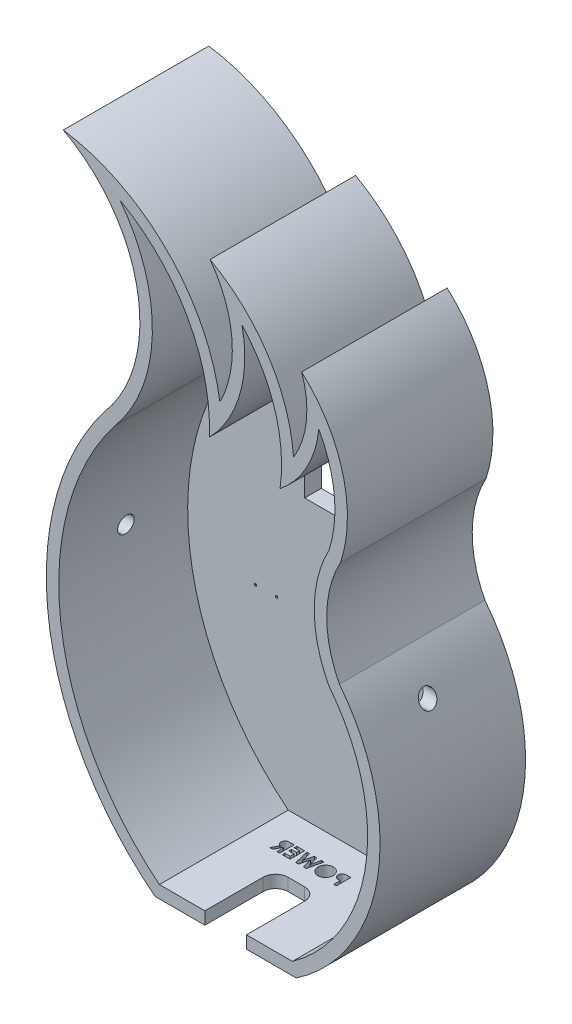
from build123d import *

# Parameters (mm, degrees)
BOSS_EXTRU_1_DEPTH           = 4
BOSS_EXTRU_4_DEPTH           = 35
ENL_V_MAT_EXTRU_1_DEPTH      = 109.428329438
ENL_V_MAT_EXTRU_1_DEPTH_BACK = 109.428329438
ENL_V_MAT_EXTRU_2_REACH      = 164.528
ESQUISSE6_R                  = 1.5
ESQUISSE6_R_2                = 2.5
ESQUISSE6_W                  = 24
ESQUISSE6_H                  = 15
ESQUISSE6_W_2                = 0.5
ESQUISSE6_H_2                = 0.5
ENL_V_MAT_EXTRU_3_DEPTH      = 109.428329601
ESQUISSE7_R                  = 5
ENL_V_MAT_EXTRU_4_DEPTH      = 1


with BuildPart() as part:
    # Esquisse1 → Boss.-Extru.1 (new body)
    with BuildSketch(Plane.XY):
        with BuildLine():
            Line((34.592208377, -83.205876128), (2.592208377, -83.205876128))
            ThreePointArc((2.592208377, -83.205876128), (-21.135858154, -40.364260111), (-8.228420805, 6.877916653))
            ThreePointArc((-8.228420805, 6.877916653), (0.893799042, 30.493713748), (-6.84321599, 54.598886756))
            ThreePointArc((-6.84321599, 54.598886756), (9.364765467, 38.345761161), (14.607820517, 15.99910306))
            ThreePointArc((14.607820517, 15.99910306), (21.976111447, 28.676093425), (22.456168695, 43.331035969))
            ThreePointArc((22.456168695, 43.331035969), (30.372692604, 29.597037977), (31.622475542, 13.794123872))
            ThreePointArc((31.622475542, 13.794123872), (38.001378496, 21.360207899), (40.944713977, 30.808636692))
            ThreePointArc((40.944713977, 30.808636692), (44.664931438, 19.085253837), (43.404645934, 6.850491723))
            ThreePointArc((43.404645934, 6.850491723), (39.847098611, -7.304052343), (43.389792333, -21.462321371))
            ThreePointArc((43.389792333, -21.462321371), (52.249922707, -54.223307802), (34.592208377, -83.205876128))
        make_face()
    extrude(amount=BOSS_EXTRU_1_DEPTH)

    # Esquisse3 → Boss.-Extru.4 (add)
    with BuildSketch(Plane.XY):
        with BuildLine():
            Line((1.54651487, -86.205876128), (35.532054588, -86.205876128))
            ThreePointArc((35.532054588, -86.205876128), (55.127345813, -55.266002734), (45.915235287, -19.820435684))
            ThreePointArc((45.915235287, -19.820435684), (42.848491015, -7.045180739), (46.174455308, 5.66505218))
            ThreePointArc((46.174455308, 5.66505218), (46.699040292, 24.566404446), (36.823600086, 40.691291659))
            ThreePointArc((36.823600086, 40.691291659), (37.958535424, 31.097022021), (34.873591151, 21.941629787))
            ThreePointArc((34.873591151, 21.941629787), (28.767463783, 40.061246758), (14.782629491, 53.100791247))
            ThreePointArc((14.782629491, 53.100791247), (20.048145675, 39.197474865), (17.15570326, 24.614551839))
            ThreePointArc((17.15570326, 24.614551839), (4.530733307, 49.705521169), (-20.51395608, 62.422051426))
            ThreePointArc((-20.51395608, 62.422051426), (-2.677497436, 37.981088624), (-10.559266028, 8.768460472))
            ThreePointArc((-10.559266028, 8.768460472), (-24.054003585, -41.210320933), (1.54651487, -86.205876128))
        make_face()
        with BuildLine():
            Line((2.592208377, -83.205876128), (34.592208377, -83.205876128))
            ThreePointArc((34.592208377, -83.205876128), (52.249922707, -54.223307802), (43.389792333, -21.462321371))
            ThreePointArc((43.389792333, -21.462321371), (39.847098611, -7.304052343), (43.404645934, 6.850491723))
            ThreePointArc((43.404645934, 6.850491723), (44.664931438, 19.085253837), (40.944713977, 30.808636692))
            ThreePointArc((40.944713977, 30.808636692), (38.001378496, 21.360207899), (31.622475542, 13.794123872))
            ThreePointArc((31.622475542, 13.794123872), (30.372692604, 29.597037977), (22.456168695, 43.331035969))
            ThreePointArc((22.456168695, 43.331035969), (21.976111447, 28.676093425), (14.607820517, 15.99910306))
            ThreePointArc((14.607820517, 15.99910306), (9.364765467, 38.345761161), (-6.84321599, 54.598886756))
            ThreePointArc((-6.84321599, 54.598886756), (0.893799042, 30.493713748), (-8.228420805, 6.877916653))
            ThreePointArc((-8.228420805, 6.877916653), (-21.135858154, -40.364260111), (2.592208377, -83.205876128))
        make_face(mode=Mode.SUBTRACT)
    extrude(amount=BOSS_EXTRU_4_DEPTH)

    # Esquisse4 → Enlèv. mat.-Extru.1 (cut, two sides: drawn at the far end of the back side and taken through both)
    with BuildSketch(Plane(origin=(0, 0, 0), x_dir=(0, 0, -1), z_dir=(1, 0, 0)).offset(-ENL_V_MAT_EXTRU_1_DEPTH_BACK)):
        with BuildLine():
            add(Edge.make_bspline(
                [(-21, -28.205876128), (-21, -28.337857478), (-20.987063571, -28.467669223), (-20.936340317, -28.723122141), (-20.897940296, -28.850084441), (-20.79762405, -29.092289965), (-20.736219813, -29.207190661), (-20.591103105, -29.424679205), (-20.506600116, -29.527694386), (-20.229641459, -29.804679288), (-20.00630231, -29.953837963), (-19.524411795, -30.153440552), (-19.260877309, -30.205916017), (-18.869102907, -30.205856149), (-18.736468273, -30.192755675), (-18.479710185, -30.14144783), (-18.35493159, -30.103530184), (-18.112617564, -30.003028482), (-17.995447069, -29.940202966), (-17.778679946, -29.795024799), (-17.67767738, -29.712169492), (-17.491015947, -29.525127406), (-17.408235442, -29.423773086), (-17.263634004, -29.206885886), (-17.201187039, -29.089882822), (-17.10116058, -28.847440434), (-17.063538557, -28.722760203), (-17.012768759, -28.466575309), (-16.999864688, -28.334144487), (-17.000273908, -27.943061162), (-17.052806967, -27.680421845), (-17.251995591, -27.199822701), (-17.400790494, -26.976885017), (-17.676983889, -26.700352659), (-17.779705149, -26.615909742), (-17.997207753, -26.470502871), (-18.11204999, -26.409018126), (-18.353968141, -26.308563097), (-18.481308283, -26.269904596), (-18.737253853, -26.218920837), (-18.867217224, -26.205926257), (-19.131268359, -26.205826286), (-19.261972106, -26.218823564), (-19.517792088, -26.269668849), (-19.644647717, -26.308067679), (-19.887281536, -26.408661877), (-20.002187961, -26.470169942), (-20.219400056, -26.615240979), (-20.322298667, -26.699707993), (-20.506737745, -26.884226558), (-20.589400692, -26.9848039), (-20.735292307, -27.202894296), (-20.797498381, -27.319356231), (-20.947021673, -27.679778766), (-21, -27.941913429), (-21, -28.205876128)],
                knots=[0, 0, 0, 0, 0.03125, 0.03125, 0.0625, 0.0625, 0.09375, 0.09375, 0.125, 0.125, 0.1875, 0.1875, 0.25, 0.25, 0.28125, 0.28125, 0.3125, 0.3125, 0.34375, 0.34375, 0.375, 0.375, 0.40625, 0.40625, 0.4375, 0.4375, 0.46875, 0.46875, 0.5, 0.5, 0.5625, 0.5625, 0.625, 0.625, 0.65625, 0.65625, 0.6875, 0.6875, 0.71875, 0.71875, 0.75, 0.75, 0.78125, 0.78125, 0.8125, 0.8125, 0.84375, 0.84375, 0.875, 0.875, 0.90625, 0.90625, 0.9375, 0.9375, 1, 1, 1, 1], degree=3))
        make_face()
    extrude(amount=ENL_V_MAT_EXTRU_1_DEPTH + ENL_V_MAT_EXTRU_1_DEPTH_BACK, mode=Mode.SUBTRACT)

    # Esquisse5 → Enlèv. mat.-Extru.2 (cut, up to next)
    with BuildSketch(Plane.XZ.offset(86.205876128), mode=Mode.PRIVATE) as enl_v_mat_extru_2_sk1:
        with BuildLine():
            Line((13.539284729, 35), (13.539284729, 21))
            ThreePointArc((13.539284729, 21), (14.417964385, 18.878679656), (16.539284729, 18))
            Line((16.539284729, 18), (20.539284729, 18))
            ThreePointArc((20.539284729, 18), (22.660605073, 18.878679656), (23.539284729, 21))
            Line((23.539284729, 21), (23.539284729, 35))
            Line((23.539284729, 35), (13.539284729, 35))
        make_face()
    enl_v_mat_extru_2_tool1 = extrude(enl_v_mat_extru_2_sk1.sketch, amount=-ENL_V_MAT_EXTRU_2_REACH, mode=Mode.PRIVATE) & part.part
    # Esquisse5 → Enlèv. mat.-Extru.2 (cut, up to next)
    with BuildSketch(Plane.XZ.offset(86.205876128), mode=Mode.PRIVATE) as enl_v_mat_extru_2_sk2:
        with BuildLine():
            Line((24.162892365, 10.5), (23.46177057, 10.5))
            add(Edge.make_bspline(
                [(23.46177057, 10.5), (23.415960181, 10.500205057), (23.327582339, 10.500600654), (23.200134223, 10.505397811), (23.08255708, 10.513994585), (22.974877994, 10.524618908), (22.877141008, 10.539513556), (22.789224474, 10.556589839), (22.711107747, 10.577391321), (22.641917663, 10.602090045), (22.579802645, 10.631183404), (22.521090871, 10.662258334), (22.466665992, 10.699092852), (22.415250267, 10.739031854), (22.367232631, 10.782906236), (22.322257263, 10.830542597), (22.280787285, 10.882633231), (22.243082686, 10.938819282), (22.208860014, 10.997956839), (22.178965773, 11.060180763), (22.154715969, 11.125581592), (22.134373755, 11.193738398), (22.118034596, 11.264647623), (22.107158754, 11.338745528), (22.099771329, 11.415514688), (22.099119491, 11.467763828), (22.098789801, 11.494190705)],
                knots=[0, 0, 0, 0, 1.698787518, 3.27731721, 4.728409951, 6.070286353, 7.288646904, 8.393455548, 9.389990496, 10.283725379, 11.113616976, 11.931887102, 12.744353494, 13.547053751, 14.344590688, 15.153907614, 15.974148981, 16.810666655, 17.660988447, 18.506082349, 19.367288142, 20.244738011, 21.142497992, 22.06302001, 23.020302899, 24, 24, 24, 24], degree=3))
            add(Edge.make_bspline(
                [(22.098789801, 11.494190705), (22.099264754, 11.523426976), (22.100198095, 11.580879842), (22.109416972, 11.665084258), (22.125010193, 11.745420189), (22.14588515, 11.82223083), (22.173113622, 11.895348142), (22.207240012, 11.964291802), (22.246275926, 12.029925726), (22.292359376, 12.091049462), (22.343281734, 12.147974158), (22.398113474, 12.201319297), (22.458499848, 12.248892295), (22.52228548, 12.293166415), (22.591295455, 12.331542946), (22.66348514, 12.367078015), (22.740685471, 12.397232775), (22.794408842, 12.413052953), (22.821646371, 12.421073718)],
                knots=[0, 0, 0, 0, 1.101767505, 2.165108537, 3.187936629, 4.183892551, 5.162396277, 6.123736501, 7.080098904, 8.036826416, 9.0040019, 9.957275584, 10.916231297, 11.898534744, 12.880877694, 13.889532316, 14.930001539, 16, 16, 16, 16], degree=3))
            add(Edge.make_bspline(
                [(22.821646371, 12.421073718), (22.839588592, 12.425537772), (22.87845722, 12.435208349), (22.942774124, 12.445026413), (23.016892603, 12.454053518), (23.10105233, 12.461811223), (23.195301826, 12.467084654), (23.299549832, 12.47120297), (23.413843592, 12.47419741), (23.493318953, 12.474303666), (23.534687237, 12.474358974)],
                knots=[0, 0, 0, 0, 0.618981996, 1.340914327, 2.176866532, 3.120127938, 4.170906482, 5.338178032, 6.614476169, 8, 8, 8, 8], degree=3))
            Line((23.534687237, 12.474358974), (23.534687237, 14))
            Line((23.534687237, 14), (24.162892365, 14))
            Line((24.162892365, 14), (24.162892365, 10.5))
        make_face()
        with BuildLine():
            Line((23.534687237, 11.846153846), (23.312431628, 11.846153846))
            add(Edge.make_bspline(
                [(23.312431628, 11.846153846), (23.27198805, 11.845898361), (23.197571265, 11.845428265), (23.095953398, 11.838594145), (23.014264542, 11.828203599), (22.949799696, 11.813179512), (22.898878956, 11.790808607), (22.855489213, 11.763826976), (22.816940138, 11.731403655), (22.784806455, 11.692533143), (22.758620608, 11.649166024), (22.740254163, 11.600974838), (22.728662051, 11.548729729), (22.727561104, 11.512249832), (22.726994929, 11.493489583)],
                knots=[0, 0, 0, 0, 1.862351722, 3.426754836, 4.68713255, 5.653025869, 6.462861518, 7.236406327, 7.999926698, 8.771672214, 9.54880311, 10.322347919, 11.137246204, 12, 12, 12, 12], degree=3))
            add(Edge.make_bspline(
                [(22.726994929, 11.493489583), (22.727543449, 11.4770949), (22.728607709, 11.445285273), (22.736533808, 11.39940838), (22.748835516, 11.356725531), (22.767636291, 11.317831711), (22.790462144, 11.281819759), (22.819419579, 11.249810734), (22.852813452, 11.220769037), (22.878638309, 11.205416166), (22.891758551, 11.197616186)],
                knots=[0, 0, 0, 0, 1.102449765, 2.139017612, 3.12397484, 4.080535277, 5.035673127, 5.982361139, 6.974944601, 8, 8, 8, 8], degree=3))
            add(Edge.make_bspline(
                [(22.891758551, 11.197616186), (22.902869344, 11.191997139), (22.926393171, 11.180100465), (22.966456528, 11.166269712), (23.012689031, 11.154601949), (23.065402801, 11.144917817), (23.124387546, 11.137401926), (23.189632745, 11.131654149), (23.26123441, 11.129342744), (23.311029084, 11.128594793), (23.33697089, 11.128205128)],
                knots=[0, 0, 0, 0, 0.656809284, 1.390599849, 2.23162475, 3.173112763, 4.218524733, 5.370385145, 6.63003504, 8, 8, 8, 8], degree=3))
            Line((23.33697089, 11.128205128), (23.534687237, 11.128205128))
            Line((23.534687237, 11.128205128), (23.534687237, 11.846153846))
        make_face(mode=Mode.SUBTRACT)
    enl_v_mat_extru_2_tool2 = extrude(enl_v_mat_extru_2_sk2.sketch, amount=-ENL_V_MAT_EXTRU_2_REACH, mode=Mode.PRIVATE) & part.part
    # Esquisse5 → Enlèv. mat.-Extru.2 (cut, up to next)
    with BuildSketch(Plane.XZ.offset(86.205876128), mode=Mode.PRIVATE) as enl_v_mat_extru_2_sk3:
        with BuildLine():
            add(Edge.make_bspline(
                [(19.825752942, 10.41025641), (19.764900849, 10.411831339), (19.644765034, 10.414940605), (19.468093862, 10.440878308), (19.297818104, 10.483091434), (19.13391335, 10.542014161), (18.976938596, 10.618324376), (18.826317078, 10.710979817), (18.682461558, 10.820766704), (18.547049246, 10.946118372), (18.422879471, 11.083186499), (18.313732829, 11.229320869), (18.221081165, 11.383012705), (18.145875585, 11.544291954), (18.08714545, 11.712937081), (18.046328698, 11.889012087), (18.020011023, 12.072291501), (18.016991221, 12.197090352), (18.015456467, 12.260516827)],
                knots=[0, 0, 0, 0, 1.014151002, 2.002163778, 2.969868608, 3.93493411, 4.9003771, 5.874719092, 6.87846472, 7.912488755, 8.947011879, 9.957751389, 10.948740761, 11.933621513, 12.919426746, 13.920294397, 14.943031967, 16, 16, 16, 16], degree=3))
            add(Edge.make_bspline(
                [(18.015456467, 12.260516827), (18.017091429, 12.323228512), (18.020313175, 12.446803899), (18.045251113, 12.62839604), (18.086777273, 12.802578596), (18.14437516, 12.969411115), (18.218265755, 13.128896333), (18.309502449, 13.280516738), (18.417485815, 13.424583864), (18.540010058, 13.5602151), (18.674066443, 13.684128709), (18.816901097, 13.792909636), (18.967187013, 13.884404437), (19.123963991, 13.960347086), (19.288711044, 14.017415825), (19.459601632, 14.060131946), (19.638065307, 14.084832759), (19.759305756, 14.088090183), (19.820845089, 14.08974359)],
                knots=[0, 0, 0, 0, 1.051517626, 2.07204922, 3.067438659, 4.05042616, 5.027204762, 6.009981242, 7.012629434, 8.042243656, 9.071350414, 10.070091277, 11.048190212, 12.017682766, 12.985867053, 13.966945899, 14.968060614, 16, 16, 16, 16], degree=3))
            add(Edge.make_bspline(
                [(19.820845089, 14.08974359), (19.885212835, 14.08827779), (20.011686656, 14.085397695), (20.196827606, 14.058240346), (20.373955828, 14.016835351), (20.542585985, 13.956890881), (20.702586988, 13.879001388), (20.854676372, 13.784955769), (20.997710291, 13.672937404), (21.13121197, 13.546324957), (21.252150725, 13.407747241), (21.358906582, 13.261361497), (21.44895659, 13.108274754), (21.522305377, 12.948418287), (21.580130553, 12.782784804), (21.620919659, 12.61036575), (21.645014754, 12.431574594), (21.648371062, 12.310136069), (21.650071852, 12.248597756)],
                knots=[0, 0, 0, 0, 1.067953136, 2.098381936, 3.099641766, 4.083805132, 5.062469929, 6.048665414, 7.046702845, 8.073106546, 9.098695993, 10.09591865, 11.076726721, 12.041940862, 13.011263376, 13.984305721, 14.978557872, 16, 16, 16, 16], degree=3))
            add(Edge.make_bspline(
                [(21.650071852, 12.248597756), (21.649530681, 12.207199796), (21.648455192, 12.124928068), (21.635784252, 12.00297392), (21.6169917, 11.883574953), (21.591265145, 11.766506639), (21.556602923, 11.652070672), (21.514473806, 11.539978393), (21.465380107, 11.430230422), (21.408766535, 11.323819274), (21.34472529, 11.222018101), (21.276346519, 11.123937766), (21.201011172, 11.032153071), (21.120274202, 10.945667009), (21.03381937, 10.864874927), (20.941496105, 10.789500956), (20.843449723, 10.71973734), (20.740740725, 10.655007593), (20.633720456, 10.59831439), (20.524935129, 10.546926154), (20.413340417, 10.505260585), (20.299746574, 10.470751849), (20.184414762, 10.443057187), (20.066454519, 10.424642598), (19.946861402, 10.411871556), (19.866218233, 10.41079607), (19.825752942, 10.41025641)],
                knots=[0, 0, 0, 0, 1.034641744, 2.056182551, 3.061960284, 4.05571729, 5.050247014, 6.048716841, 7.047801973, 8.054190544, 9.059424999, 10.053182006, 11.041513076, 12.025412457, 13.009311837, 13.997642908, 15.002928308, 16.016213968, 17.030509951, 18.02913364, 19.022134519, 20.005478534, 20.996155877, 21.984625117, 22.988721131, 24, 24, 24, 24], degree=3))
        make_face()
        with BuildLine():
            add(Edge.make_bspline(
                [(19.835568647, 11.038461538), (19.876521891, 11.039560407), (19.957347207, 11.041729135), (20.075903261, 11.058251865), (20.189721128, 11.084640646), (20.298170484, 11.122864107), (20.401719098, 11.171514181), (20.500558982, 11.230414994), (20.593289359, 11.30161371), (20.681270323, 11.381202759), (20.760478619, 11.470249581), (20.831697607, 11.564638711), (20.889281049, 11.666641313), (20.938794589, 11.772897694), (20.975367996, 11.886094968), (21.003214832, 12.004395951), (21.018382058, 12.129015087), (21.02068862, 12.213737994), (21.021866724, 12.257011218)],
                knots=[0, 0, 0, 0, 1.033668485, 2.040047952, 3.016132939, 3.979056467, 4.937231767, 5.900589077, 6.877725736, 7.88429546, 8.891280164, 9.882584218, 10.863295226, 11.842887319, 12.837417301, 13.860812229, 14.907384602, 16, 16, 16, 16], degree=3))
            add(Edge.make_bspline(
                [(21.021866724, 12.257011218), (21.020434681, 12.304981039), (21.017628115, 12.398993941), (20.998168059, 12.536210947), (20.964070247, 12.665649698), (20.917488528, 12.78774321), (20.855568135, 12.9012076), (20.781509948, 13.007418434), (20.693459711, 13.105716727), (20.625745728, 13.163155183), (20.591377942, 13.192307692)],
                knots=[0, 0, 0, 0, 1.078343132, 2.113373867, 3.107373148, 4.082093053, 5.043582658, 6.005574554, 6.987742499, 8, 8, 8, 8], degree=3))
            add(Edge.make_bspline(
                [(20.591377942, 13.192307692), (20.563216663, 13.213841032), (20.507528585, 13.256422561), (20.418638287, 13.310999526), (20.327098783, 13.357777429), (20.232219294, 13.395573422), (20.134200199, 13.425303114), (20.033054941, 13.446122329), (19.928926832, 13.459188186), (19.858510526, 13.460749804), (19.822948455, 13.461538462)],
                knots=[0, 0, 0, 0, 1.023928204, 2.024787132, 3.009472467, 3.9914905, 4.972207045, 5.96565515, 6.972602802, 8, 8, 8, 8], degree=3))
            add(Edge.make_bspline(
                [(19.822948455, 13.461538462), (19.782700181, 13.460428703), (19.703510438, 13.458245219), (19.587150245, 13.441948345), (19.475725355, 13.414247454), (19.368202976, 13.376630647), (19.266022913, 13.32621761), (19.167591745, 13.266355995), (19.074082603, 13.195178847), (18.986635422, 13.113584088), (18.906494755, 13.024533066), (18.835592567, 12.929633395), (18.776873867, 12.82888138), (18.727894998, 12.723622851), (18.689735004, 12.61301973), (18.663620024, 12.497063674), (18.646836425, 12.376222513), (18.644733106, 12.293993782), (18.643661596, 12.252103365)],
                knots=[0, 0, 0, 0, 1.026350473, 2.019376834, 2.989435443, 3.95094063, 4.91865229, 5.889827372, 6.885283771, 7.910196595, 8.935871797, 9.9372888, 10.925850568, 11.904605667, 12.894245083, 13.903507864, 14.931967858, 16, 16, 16, 16], degree=3))
            add(Edge.make_bspline(
                [(18.643661596, 12.252103365), (18.644766029, 12.210452112), (18.646939939, 12.128467972), (18.66332814, 12.007962039), (18.690572967, 11.892643124), (18.729078614, 11.782213962), (18.777048639, 11.67609481), (18.837306976, 11.57520669), (18.908547496, 11.479636889), (18.989467862, 11.389953581), (19.077530219, 11.307534841), (19.172077777, 11.236011765), (19.270460467, 11.173860119), (19.374936851, 11.125173118), (19.483369123, 11.086384264), (19.596419024, 11.057819602), (19.714514715, 11.041845204), (19.794857657, 11.039599481), (19.835568647, 11.038461538)],
                knots=[0, 0, 0, 0, 1.055040155, 2.076685641, 3.074845078, 4.052329834, 5.035358467, 6.020382375, 7.023447318, 8.050688466, 9.077178457, 10.074336316, 11.0503314, 12.019748348, 12.988025369, 13.964577102, 14.968620271, 16, 16, 16, 16], degree=3))
        make_face(mode=Mode.SUBTRACT)
    enl_v_mat_extru_2_tool3 = extrude(enl_v_mat_extru_2_sk3.sketch, amount=-ENL_V_MAT_EXTRU_2_REACH, mode=Mode.PRIVATE) & part.part
    # Esquisse5 → Enlèv. mat.-Extru.2 (cut, up to next)
    with BuildSketch(Plane.XZ.offset(86.205876128), mode=Mode.PRIVATE) as enl_v_mat_extru_2_sk4:
        Polygon((17.723789801, 10.5), (17.07525214, 10.5), (16.557123134, 12.73447516), (15.963272974, 10.5), (15.35259589, 10.5), (14.762251339, 12.73447516), (14.245524576, 10.5), (13.595584673, 10.5), (14.405380346, 14), (15.061630346, 14), (15.659687237, 11.737479968), (16.261249737, 14), (16.912591884, 14), align=None)
    enl_v_mat_extru_2_tool4 = extrude(enl_v_mat_extru_2_sk4.sketch, amount=-ENL_V_MAT_EXTRU_2_REACH, mode=Mode.PRIVATE) & part.part
    # Esquisse5 → Enlèv. mat.-Extru.2 (cut, up to next)
    with BuildSketch(Plane.XZ.offset(86.205876128), mode=Mode.PRIVATE) as enl_v_mat_extru_2_sk5:
        Polygon((13.034687237, 10.5), (11.150071852, 10.5), (11.150071852, 11.128205128), (12.406482108, 11.128205128), (12.406482108, 11.801282051), (11.150071852, 11.801282051), (11.150071852, 12.429487179), (12.406482108, 12.429487179), (12.406482108, 13.371794872), (11.150071852, 13.371794872), (11.150071852, 14), (13.034687237, 14), align=None)
    enl_v_mat_extru_2_tool5 = extrude(enl_v_mat_extru_2_sk5.sketch, amount=-ENL_V_MAT_EXTRU_2_REACH, mode=Mode.PRIVATE) & part.part
    # Esquisse5 → Enlèv. mat.-Extru.2 (cut, up to next)
    with BuildSketch(Plane.XZ.offset(86.205876128), mode=Mode.PRIVATE) as enl_v_mat_extru_2_sk6:
        with BuildLine():
            Line((10.521866724, 10.5), (9.78989557, 10.5))
            add(Edge.make_bspline(
                [(9.78989557, 10.5), (9.741512069, 10.500168693), (9.648456968, 10.500493138), (9.514283486, 10.505744454), (9.391002327, 10.512861042), (9.278339602, 10.524388592), (9.176423709, 10.537634707), (9.08546248, 10.555416726), (9.005117619, 10.575142905), (8.934400787, 10.599416995), (8.870737578, 10.627326794), (8.811627649, 10.65892228), (8.755594131, 10.695063276), (8.703045044, 10.735633755), (8.652363297, 10.779092926), (8.606262345, 10.827966617), (8.562685603, 10.880655192), (8.522090766, 10.937162062), (8.485642416, 10.997355322), (8.454213029, 11.060515376), (8.427151382, 11.126259099), (8.40573481, 11.194826713), (8.38865497, 11.266023019), (8.377233528, 11.33967137), (8.368747426, 11.415936426), (8.3682661, 11.46775665), (8.36802057, 11.494190705)],
                knots=[0, 0, 0, 0, 1.748592178, 3.36303531, 4.852592433, 6.210838904, 7.455605234, 8.565530618, 9.559147328, 10.443333557, 11.264119507, 12.069061813, 12.863340979, 13.67089394, 14.467102114, 15.273638367, 16.095597024, 16.937114566, 17.786018611, 18.63597263, 19.484582448, 20.352808207, 21.22970172, 22.128176732, 23.04516274, 24, 24, 24, 24], degree=3))
            add(Edge.make_bspline(
                [(8.36802057, 11.494190705), (8.368666827, 11.521780349), (8.369934018, 11.575878611), (8.376703212, 11.65535499), (8.389287938, 11.731576791), (8.407728188, 11.804054868), (8.429800083, 11.873531522), (8.458385314, 11.938922401), (8.490891123, 12.001384261), (8.529453554, 12.05988779), (8.571800592, 12.115690246), (8.620981657, 12.166764904), (8.674217823, 12.215532911), (8.7331291, 12.260333545), (8.797539115, 12.300887913), (8.8662367, 12.338843275), (8.940171256, 12.373525481), (8.992104415, 12.392924453), (9.018661596, 12.402844551)],
                knots=[0, 0, 0, 0, 1.099808295, 2.156523617, 3.176426857, 4.17500812, 5.135317955, 6.078349783, 7.015890908, 7.9382699, 8.868004242, 9.803692517, 10.759882289, 11.743580734, 12.748787378, 13.791075452, 14.870417076, 16, 16, 16, 16], degree=3))
            Line((9.018661596, 12.402844551), (8.210969288, 14))
            Line((8.210969288, 14), (8.909286596, 14))
            Line((8.909286596, 14), (9.68052057, 12.474358974))
            Line((9.68052057, 12.474358974), (9.893661596, 12.474358974))
            Line((9.893661596, 12.474358974), (9.893661596, 14))
            Line((9.893661596, 14), (10.521866724, 14))
            Line((10.521866724, 14), (10.521866724, 10.5))
        make_face()
        with BuildLine():
            Line((9.893661596, 11.846153846), (9.648970089, 11.846153846))
            add(Edge.make_bspline(
                [(9.648970089, 11.846153846), (9.619054514, 11.845816922), (9.561772615, 11.845171784), (9.479393797, 11.84217926), (9.404573918, 11.834969123), (9.336992828, 11.825858432), (9.276306764, 11.815341805), (9.22306882, 11.800260708), (9.176421232, 11.784130369), (9.137033765, 11.763988461), (9.103244691, 11.74148554), (9.074922545, 11.714793749), (9.049971753, 11.685554308), (9.030400136, 11.651926871), (9.014587531, 11.615289149), (9.004781064, 11.574951838), (8.997000561, 11.531645292), (8.99649091, 11.501476463), (8.996225698, 11.485777244)],
                knots=[0, 0, 0, 0, 1.688935225, 3.233948049, 4.651771667, 5.929878493, 7.083962697, 8.124219224, 9.050753627, 9.864999381, 10.615157594, 11.334035464, 12.05533055, 12.777108108, 13.522027315, 14.29964284, 15.115170198, 16, 16, 16, 16], degree=3))
            add(Edge.make_bspline(
                [(8.996225698, 11.485777244), (8.996903385, 11.467217722), (8.998226293, 11.430987781), (9.012530665, 11.378683077), (9.034114168, 11.329919365), (9.064669914, 11.285372104), (9.102789549, 11.246395907), (9.146473432, 11.212244253), (9.196559202, 11.184909999), (9.242806281, 11.16626714), (9.285575017, 11.15552148), (9.323915474, 11.147835117), (9.368397512, 11.141608332), (9.418957866, 11.137025693), (9.475503626, 11.132665222), (9.53816898, 11.129965621), (9.606897931, 11.128760999), (9.6548124, 11.128395754), (9.679819448, 11.128205128)],
                knots=[0, 0, 0, 0, 1.020050218, 1.991234449, 2.965145773, 3.94719294, 4.948794399, 5.958308566, 6.989992871, 8.082620171, 8.694688219, 9.416833949, 10.236190632, 11.167557654, 12.21328564, 13.36031274, 14.622320386, 16, 16, 16, 16], degree=3))
            Line((9.679819448, 11.128205128), (9.893661596, 11.128205128))
            Line((9.893661596, 11.128205128), (9.893661596, 11.846153846))
        make_face(mode=Mode.SUBTRACT)
    enl_v_mat_extru_2_tool6 = extrude(enl_v_mat_extru_2_sk6.sketch, amount=-ENL_V_MAT_EXTRU_2_REACH, mode=Mode.PRIVATE) & part.part
    add(enl_v_mat_extru_2_tool1.solids().sort_by_distance((18.539285, -86.205876, 26.682052))[0], mode=Mode.SUBTRACT)
    add(enl_v_mat_extru_2_tool2.solids().sort_by_distance((23.374357, -86.205876, 11.894453))[0], mode=Mode.SUBTRACT)
    add(enl_v_mat_extru_2_tool3.solids().sort_by_distance((18.575016, -86.205876, 10.99535))[0], mode=Mode.SUBTRACT)
    add(enl_v_mat_extru_2_tool4.solids().sort_by_distance((17.399521, -86.205876, 10.554122))[0], mode=Mode.SUBTRACT)
    add(enl_v_mat_extru_2_tool5.solids().sort_by_distance((12.231981, -86.205876, 12.226733))[0], mode=Mode.SUBTRACT)
    add(enl_v_mat_extru_2_tool6.solids().sort_by_distance((9.543411, -86.205876, 12.159351))[0], mode=Mode.SUBTRACT)


with BuildPart() as enl_v_mat_extru_2_kept_piece:
    # of the separate pieces the step leaves, the one the design keeps (enl_v_mat_extru_2_pieces_kept)
    add(part.part.solids().sort_by_distance((-10.559266028, 8.768460472, 0))[0])

    # Esquisse6 → Enlèv. mat.-Extru.3 (cut, through all)
    with BuildSketch(Plane.XY):
        with Locations((18.539284729, 2.794123872)):
            Circle(ESQUISSE6_R)
        with Locations((18.539284729, -20.205876128)):
            Circle(ESQUISSE6_R)
        with Locations((38.539284729, -40.205876128)):
            Circle(ESQUISSE6_R_2)
        with Locations((18.539284729, -8.705876128)):
            Rectangle(ESQUISSE6_W, ESQUISSE6_H)
        with Locations((-0.252750927, -40.205876128)):
            Rectangle(ESQUISSE6_W_2, ESQUISSE6_H_2)
        with Locations((-5.252750927, -40.205876128)):
            Rectangle(ESQUISSE6_W_2, ESQUISSE6_H_2)
    extrude(amount=ENL_V_MAT_EXTRU_3_DEPTH, mode=Mode.SUBTRACT)

    # Esquisse7 → Enlèv. mat.-Extru.4 (cut)
    with BuildSketch(Plane(origin=(0, 0, 0), x_dir=(-1, 0, 0), z_dir=(0, 0, -1))):
        with Locations((2.752750927, -40.205876128)):
            Circle(ESQUISSE7_R)
        Polygon((2.752750927, -47.705876128), (2.752750927, -52.705876128), (4.252750927, -52.705876128), (6.752750927, -55.205876128), (6.752750927, -45.205876128), (4.252750927, -47.705876128), align=None)
        with BuildLine():
            Line((10.391043608, -48.178541214), (11.33058104, -47.655010754))
            ThreePointArc((11.33058104, -47.655010754), (12.432247306, -50.205876128), (11.33058104, -52.756741503))
            Line((11.33058104, -52.756741503), (10.391043608, -52.233211043))
            ThreePointArc((10.391043608, -52.233211043), (11.428199412, -50.205876128), (10.391043608, -48.178541214))
        make_face()
        with BuildLine():
            Line((12.397448625, -47.060529195), (13.976725893, -46.180521943))
            ThreePointArc((13.976725893, -46.180521943), (15.385063662, -50.205876128), (13.976725893, -54.231230314))
            Line((13.976725893, -54.231230314), (12.397448625, -53.351223061))
            ThreePointArc((12.397448625, -53.351223061), (13.611029478, -50.205876128), (12.397448625, -47.060529195))
        make_face()
        Polygon((-26.539284729, -80.205876128), (-10.539284729, -80.205876128), (-10.539284729, -75.205876128), (-4.539284729, -75.205876128), (-18.539284729, -65.205876128), (-32.539284729, -75.205876128), (-26.539284729, -75.205876128), align=None)
        with BuildLine():
            Line((-10.667427438, -68.985275922), (-6.667427438, -68.985275922))
            ThreePointArc((-6.667427438, -68.985275922), (-7.839000314, -66.156848797), (-10.667427438, -64.985275922))
            Line((-10.667427438, -64.985275922), (-10.667427438, -68.985275922))
        make_face()
        with BuildLine():
            Line((-5.667427438, -68.985275922), (-4.667427438, -68.985275922))
            ThreePointArc((-4.667427438, -68.985275922), (-6.424786751, -64.742635234), (-10.667427438, -62.985275922))
            Line((-10.667427438, -62.985275922), (-10.667427438, -63.985275922))
            ThreePointArc((-10.667427438, -63.985275922), (-7.131893533, -65.449742016), (-5.667427438, -68.985275922))
        make_face()
        with BuildLine():
            Line((-3.667427438, -68.985275922), (-2.667427438, -68.985275922))
            ThreePointArc((-2.667427438, -68.985275922), (-5.010573189, -63.328421672), (-10.667427438, -60.985275922))
            Line((-10.667427438, -60.985275922), (-10.667427438, -61.985275922))
            ThreePointArc((-10.667427438, -61.985275922), (-5.71767997, -64.035528453), (-3.667427438, -68.985275922))
        make_face()
        with BuildLine():
            Line((-1.667427438, -68.985275922), (-0.667427438, -68.985275922))
            ThreePointArc((-0.667427438, -68.985275922), (-3.596359627, -61.91420811), (-10.667427438, -58.985275922))
            Line((-10.667427438, -58.985275922), (-10.667427438, -59.985275922))
            ThreePointArc((-10.667427438, -59.985275922), (-4.303466408, -62.621314891), (-1.667427438, -68.985275922))
        make_face()
    extrude(amount=-ENL_V_MAT_EXTRU_4_DEPTH, mode=Mode.SUBTRACT)


solid = enl_v_mat_extru_2_kept_piece.part
